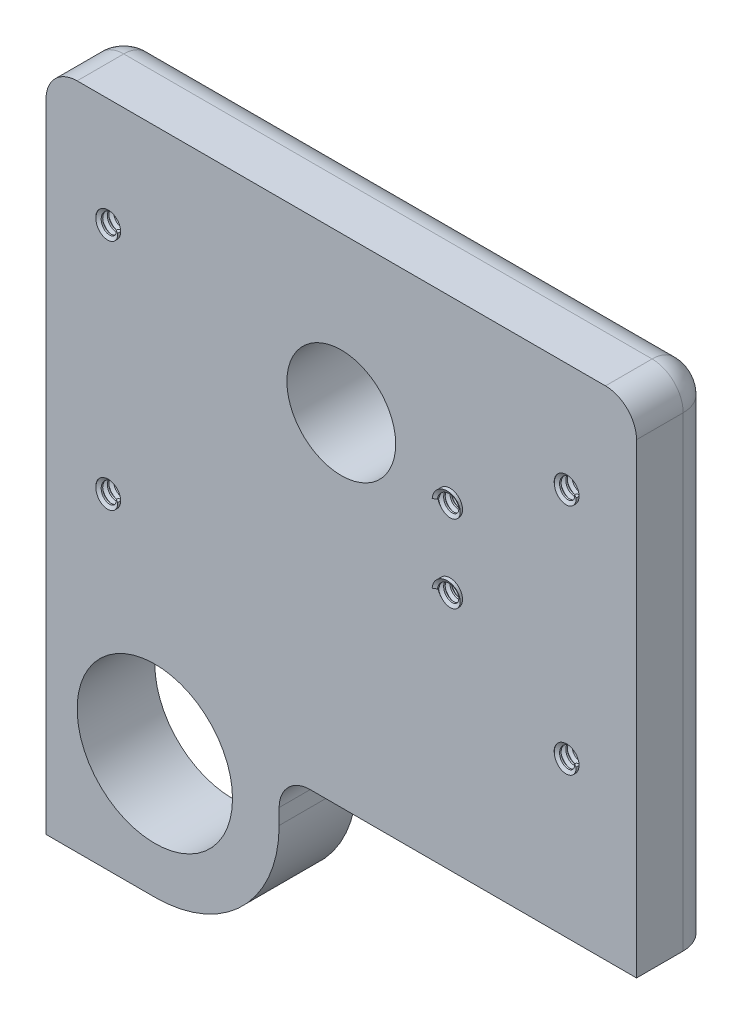
from build123d import *

# Parameters (mm, degrees)
BOSS_EXTRUDE1_DEPTH  = 5
FILLET1_R            = 2
FILLET2_R            = 2
HOLE1_OUTLINE_R      = 5
HOLE1_DEPTH          = 6
FILLET3_R            = 2
M2_TAPPED_HOLE2_D    = 1.6
THREAD2_PITCH        = 0.4
LPATTERN4_COUNT      = 2
LPATTERN4_PITCH      = 5
HOLE2_START          = -1
HOLE2_OUTLINE_R      = 3.5
HOLE2_DEPTH          = 6
THREAD4_PITCH        = 0.4
LPATTERN5_COUNT      = 2
LPATTERN5_PITCH      = 29.5
LPATTERN5_COUNT_DIR2 = 2
LPATTERN5_PITCH_DIR2 = 15


with BuildPart() as part:
    # Sketch1 → Boss-Extrude1 (new body)
    with BuildSketch(Plane.XY):
        with BuildLine():
            Line((0, 0), (0, 43))
            Line((0, 43), (38, 43))
            Line((38, 43), (38, 11))
            Line((38, 11), (15, 11))
            Line((15, 11), (15, 8))
            ThreePointArc((15, 8), (12.65685424949238, 2.3431457505076203), (7, 0))
            Line((7, 0), (0, 0))
        make_face()
    extrude(amount=BOSS_EXTRUDE1_DEPTH)

    # Fillet1
    fillet1_edges = [part.edges().sort_by_distance(p)[0] for p in [
        (0, 43, 2.5),
        (38, 43, 2.5),
        (0, 21.5, 0),
        (19, 43, 0),
    ]]
    fillet(fillet1_edges, radius=FILLET1_R)

    # Sketch5 → CBORE for M2 Hex Socket Head Cap Screw2 (revolve, cut)
    with BuildSketch(Plane(origin=(4, 36, 0), x_dir=(0, 1, 0), z_dir=(1, 0, 0))):
        Polygon((0, 0), (-8.1e-16, 3.321032742833073), (1.1999999999999993, 2.6000000000000005), (1.199999999999999, 2.4), (2.1999999999999935, 2.3999999999999995), (2.1999999999999935, 0), align=None)
    cbore_for_m2_hex_socket_head_cap_screw2 = revolve(axis=Axis((4, 36, -6.349999999999991), (0, 0, 1)), mode=Mode.SUBTRACT)

    # Fillet2
    # the kernel refuses this fillet: 2 mm, written as the material it takes off along each edge
    with BuildSketch(Plane(origin=(36, 41, 2), x_dir=(1, 0, 0), z_dir=(0, 0, -1))) as fillet2_piece_1_section:
        Polygon((0, 0), (FILLET2_R, 0), (FILLET2_R, -FILLET2_R), (0, -FILLET2_R), align=None)
    fillet2_piece_1 = extrude(amount=FILLET2_R, mode=Mode.PRIVATE)
    fillet2_piece_1 = fillet2_piece_1 - Plane(origin=(36, 41, 2), x_dir=(-0.7071067811865475, -0.7071067811865475, 0), z_dir=(0, 0, -1)) * Sphere(FILLET2_R, mode=Mode.PRIVATE)
    add(fillet2_piece_1, mode=Mode.SUBTRACT)
    with BuildSketch(Plane(origin=(38, 41, 0), x_dir=(-1, 0, 0), z_dir=(0, -1, 0))) as fillet2_piece_2:
        with BuildLine():
            CenterArc((FILLET2_R, -FILLET2_R), FILLET2_R, 90, 90)
            Line((0, -FILLET2_R), (0, 0))
            Line((0, 0), (FILLET2_R, 0))
        make_face()
    extrude(amount=35, mode=Mode.SUBTRACT)

    # Hole1: read off the stored shape, not the designer's step
    # Hole1 outline → Hole1 (cut)
    with BuildSketch(Plane.XY):
        with Locations((7, 8)):
            Circle(HOLE1_OUTLINE_R)
    extrude(amount=HOLE1_DEPTH, mode=Mode.SUBTRACT)

    # Fillet3
    fillet3_edges = [part.edges().sort_by_distance(p)[0] for p in [
        (15, 11, 2.5),
    ]]
    fillet(fillet3_edges, radius=FILLET3_R)

    # M2 Tapped Hole2 (through all)
    with Locations(Plane(origin=(0, 0, 0), x_dir=(-1, 0, 0), z_dir=(0, 0, -1))):
        with Locations((-26, 31.5)):
            m2_tapped_hole2 = Hole(M2_TAPPED_HOLE2_D / 2)

    # Thread2: arcs per turn and ends read off the stored shape
    # Thread2: the profile of Thread Profile2 profile screwed along a right-hand helix through 12.5 turns, 6 arcs to a turn; built about Z, then put on its axis
    thread2_z = Axis((0, 0, 0), (0, 0, 1))
    thread2_corners = [(0.8003, 0, -0.000173205), (0.8003, 0, 0.350173204), (0.58349365, 0, 0.224999999), (0.58349365, 0, 0.124999999)]
    with BuildLine(mode=Mode.PRIVATE) as thread2_profile:
        Line(thread2_corners[0], thread2_corners[1])
        Line(thread2_corners[1], thread2_corners[2])
        Line(thread2_corners[2], thread2_corners[3])
        Line(thread2_corners[3], thread2_corners[0])
    thread2_cap = Face(thread2_profile.wire())
    thread2_turn_angles = [0, 30, 60, 90, 120, 150, 180, 210, 240, 270, 300, 330, 360]
    thread2_turn_weights = [1, 0.8660254037844387, 1, 0.8660254037844387, 1, 0.8660254037844387, 1, 0.8660254037844387, 1, 0.8660254037844387, 1, 0.8660254037844387, 1]
    thread2_turn_rails = [Edge.make_bspline([Vector(p[0], p[1], 0).rotate(thread2_z, thread2_turn_angles[k]) / thread2_turn_weights[k] + Vector(0, 0, p[2] + THREAD2_PITCH * thread2_turn_angles[k] / 360) for k in range(13)], [0, 0, 0, 1, 1, 2, 2, 3, 3, 4, 4, 5, 5, 6, 6, 6], 2, thread2_turn_weights) for p in thread2_corners]
    thread2_turn_sides = [Face.make_surface_from_curves(thread2_turn_rails[p[0]], thread2_turn_rails[p[1]]) for p in [(0, 1), (1, 2), (2, 3), (3, 0)]]
    thread2_last_angles = [4320, 4350, 4380, 4410, 4440, 4470, 4500]
    thread2_last_weights = [1, 0.8660254037844387, 1, 0.8660254037844387, 1, 0.8660254037844387, 1]
    thread2_last_rails = [Edge.make_bspline([Vector(p[0], p[1], 0).rotate(thread2_z, thread2_last_angles[k]) / thread2_last_weights[k] + Vector(0, 0, p[2] + THREAD2_PITCH * thread2_last_angles[k] / 360) for k in range(7)], [0, 0, 0, 1, 1, 2, 2, 3, 3, 3], 2, thread2_last_weights) for p in thread2_corners]
    thread2_last_sides = [Face.make_surface_from_curves(thread2_last_rails[p[0]], thread2_last_rails[p[1]]) for p in [(0, 1), (1, 2), (2, 3), (3, 0)]]
    thread2 = Plane(origin=(26, 31.5, 0), x_dir=(1, 0, 0), z_dir=(0, 0, 1)) * Solid(Shell([*[p.moved(Location((0, 0, THREAD2_PITCH * i))) for i in range(12) for p in thread2_turn_sides], *thread2_last_sides, thread2_cap, thread2_cap.rotate(thread2_z, 4500).moved(Location((0, 0, THREAD2_PITCH * 4500 / 360)))]))
    add(thread2)

    # LPattern4: M2 Tapped Hole2, Thread2 ×2
    with Locations(*[(0, -i * LPATTERN4_PITCH, 0) for i in range(1, LPATTERN4_COUNT)]):
        add(m2_tapped_hole2, mode=Mode.SUBTRACT)
        add(thread2)

    # Hole2: read off the stored shape, not the designer's step
    # Hole2 outline → Hole2 (cut)
    with BuildSketch(Plane.XY.offset(HOLE2_START)):
        with Locations((19, 33)):
            Circle(HOLE2_OUTLINE_R)
    extrude(amount=HOLE2_DEPTH, mode=Mode.SUBTRACT)

    # Sketch19 → M2 Tapped Hole6 (revolve, cut)
    with BuildSketch(Plane(origin=(4, 36, 0), x_dir=(0, 1, 0), z_dir=(1, 0, 0))):
        Polygon((0, 0), (-1.31e-15, 5.354999998907525), (0.7999999999999987, 5.354999998907525), (0.7999999999999883, -1.46e-15), align=None)
    m2_tapped_hole6 = revolve(axis=Axis((4, 36, -6.349999999999991), (0, 0, 1)), mode=Mode.SUBTRACT)

    # Thread4: arcs per turn and ends read off the stored shape
    # Thread4: the profile of Thread Profile4 profile screwed along a right-hand helix through 5 turns, 6 arcs to a turn; built about Z, then put on its axis
    thread4_z = Axis((0, 0, 0), (0, 0, 1))
    thread4_corners = [(0.8003, 0, -0.000173205), (0.8003, 0, 0.350173204), (0.58349365, 0, 0.224999999), (0.58349365, 0, 0.124999999)]
    with BuildLine(mode=Mode.PRIVATE) as thread4_profile:
        Line(thread4_corners[0], thread4_corners[1])
        Line(thread4_corners[1], thread4_corners[2])
        Line(thread4_corners[2], thread4_corners[3])
        Line(thread4_corners[3], thread4_corners[0])
    thread4_cap = Face(thread4_profile.wire())
    thread4_turn_angles = [0, 30, 60, 90, 120, 150, 180, 210, 240, 270, 300, 330, 360]
    thread4_turn_weights = [1, 0.8660254037844387, 1, 0.8660254037844387, 1, 0.8660254037844387, 1, 0.8660254037844387, 1, 0.8660254037844387, 1, 0.8660254037844387, 1]
    thread4_turn_rails = [Edge.make_bspline([Vector(p[0], p[1], 0).rotate(thread4_z, thread4_turn_angles[k]) / thread4_turn_weights[k] + Vector(0, 0, p[2] + THREAD4_PITCH * thread4_turn_angles[k] / 360) for k in range(13)], [0, 0, 0, 1, 1, 2, 2, 3, 3, 4, 4, 5, 5, 6, 6, 6], 2, thread4_turn_weights) for p in thread4_corners]
    thread4_turn_sides = [Face.make_surface_from_curves(thread4_turn_rails[p[0]], thread4_turn_rails[p[1]]) for p in [(0, 1), (1, 2), (2, 3), (3, 0)]]
    thread4 = Plane(origin=(4, 36, 2.840344248), x_dir=(1, 0, 0), z_dir=(0, 0, 1)) * Solid(Shell([*[p.moved(Location((0, 0, THREAD4_PITCH * i))) for i in range(5) for p in thread4_turn_sides], thread4_cap, thread4_cap.rotate(thread4_z, 1800).moved(Location((0, 0, THREAD4_PITCH * 1800 / 360)))]))
    add(thread4)

    # LPattern5: CBORE for M2 Hex Socket Head Cap Screw2, M2 Tapped Hole6, Thread4 2 × 2
    with Locations(*[(i * LPATTERN5_PITCH, -j * LPATTERN5_PITCH_DIR2, 0) for i in range(LPATTERN5_COUNT) for j in range(LPATTERN5_COUNT_DIR2) if (i, j) != (0, 0)]):
        add(cbore_for_m2_hex_socket_head_cap_screw2, mode=Mode.SUBTRACT)
        add(m2_tapped_hole6, mode=Mode.SUBTRACT)
        add(thread4)


solid = part.part
